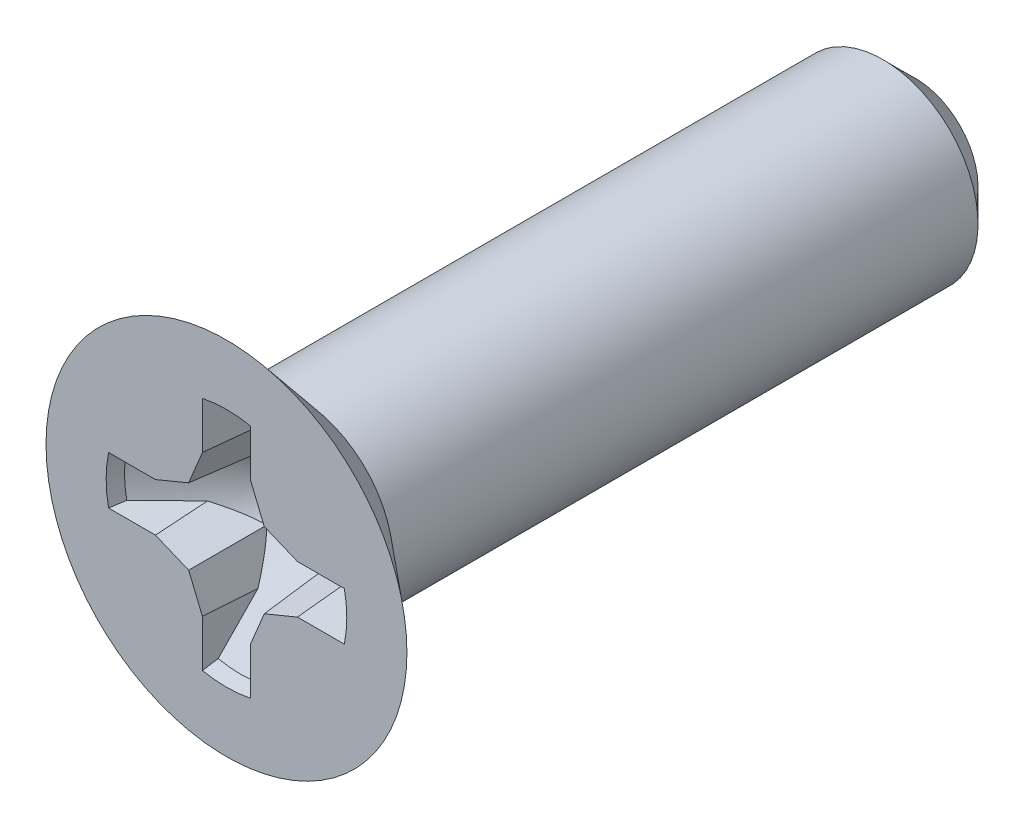
from build123d import *

# Parameters (mm, degrees)
SKETCH1_R          = 3.3274
EXTRUDE3_DEPTH     = 1.524
SKETCH4_W          = 12.7
SKETCH4_H          = 1.7526
CHAMFER1_SIZE      = 0.5953125
SKETCH26_R         = 0.8763
EXTRUDE8_DEPTH     = 1.524
CUT_EXTRUDE3_REACH = 15.544
CIRPATTERN1_COUNT  = 4
DRAFT2_ANGLE       = 5


# Read off the part's stored shape, not the designer's step: Extrude10, Draft1
with BuildPart() as part:
    # Sketch1 → Extrude3 (new body)
    with BuildSketch(Plane.XY):
        with Locations(Location((0, 0, 0), (0, 0, 180))):
            Circle(SKETCH1_R)
    extrude(amount=EXTRUDE3_DEPTH)

    # Sketch11 → Cut-Revolve3 (revolve, cut)
    with BuildSketch(Plane(origin=(0, 0, 0), x_dir=(0, 0, -1), z_dir=(1, 0, 0)), mode=Mode.PRIVATE) as cut_revolve3_sk:
        Polygon((0, 1.511167525), (-1.524, 3.3274), (0, 3.3274), align=None)
    revolve(cut_revolve3_sk.sketch.rotate(Axis((0, 0, -0.441444004), (0, 0, 1)), 90), axis=Axis((0, 0, -0.441444004), (0, 0, 1)), mode=Mode.SUBTRACT)

    # Extrude10 outline → Extrude10 (revolve)
    with BuildSketch(Plane.XZ):
        Polygon((1.7526, 0), (1.7526, 0.202585901), (1.511167525, 0.202585901), (1.511167525, 0), (0, 0), (0, -1.7526), align=None)
    revolve(axis=Axis((0, 0, 0), (0, 0, 1)))



with BuildPart() as body_2:
    # Sketch4 → Revolve1 (revolve)
    with BuildSketch(Plane(origin=(0, 0, 0), x_dir=(0, 0, -1), z_dir=(1, 0, 0)), mode=Mode.PRIVATE) as revolve1_sk:
        with Locations((4.826, 0.8763)):
            Rectangle(SKETCH4_W, SKETCH4_H)
    revolve(revolve1_sk.sketch.rotate(Axis((0, 0, 1.524), (0, 0, -1)), 180), axis=Axis((0, 0, 1.524), (0, 0, -1)))

    # Chamfer1
    chamfer1_edges = [body_2.edges().sort_by_distance(p)[0] for p in [
        (0, 1.7526, -11.176),
    ]]
    chamfer(chamfer1_edges, length=CHAMFER1_SIZE)


with BuildPart() as part_1:
    add(part.part)

    add(body_2.part)  # Extrude8 merges body 2
    # Sketch26 → Extrude8 (add)
    with BuildSketch(Plane.XY.offset(1.524)):
        Circle(SKETCH26_R)
    extrude(amount=-EXTRUDE8_DEPTH)

    # Cut-Extrude3: up to this cone (the profile starts inside it)
    cut_extrude3_end = Plane(origin=(0, 0, 1.524), z_dir=(0, 0, 1)).offset(-2.068083744) * Cone(1.192e-06, 24.522394484, 20.576731167, align=(Align.CENTER, Align.CENTER, Align.MIN), mode=Mode.PRIVATE)
    # Sketch12 → Cut-Extrude3 (cut, up to the surface)
    with BuildSketch(Plane.XY.offset(1.524), mode=Mode.PRIVATE) as cut_extrude3_sk1:
        with BuildLine():
            Line((2.173448579, 0.443653333), (1.308550956, 0.443653333))
            Line((1.308550956, 0.443653333), (0.696975982, 0.696975982))
            Line((0.696975982, 0.696975982), (0.443653333, 1.308550956))
            Line((0.443653333, 1.308550956), (0.443653333, 2.173448579))
            ThreePointArc((0.443653333, 2.173448579), (0.22295568, 2.207033704), (0, 2.218266667))
            Line((0, 2.218266667), (0, 0))
            Line((0, 0), (2.218266667, 0))
            ThreePointArc((2.218266667, 0), (2.207033704, 0.22295568), (2.173448579, 0.443653333))
        make_face()
    cut_extrude3_tool1 = extrude(cut_extrude3_sk1.sketch, amount=-CUT_EXTRUDE3_REACH, mode=Mode.PRIVATE) & cut_extrude3_end
    cut_extrude3 = cut_extrude3_tool1.solids().sort_by_distance((1.741, 0.412282, 1.524))[0]
    add(cut_extrude3, mode=Mode.SUBTRACT)

    # CirPattern1: Cut-Extrude3 ×4 about axis
    cirpattern1_axis = Axis((0, 0, 0), (0, 0, 1))
    for i in range(1, CIRPATTERN1_COUNT):
        add(cut_extrude3.rotate(cirpattern1_axis, i * 360 / CIRPATTERN1_COUNT), mode=Mode.SUBTRACT)

    # Draft1 outline → Draft1 (revolve)
    with BuildSketch(Plane.XZ):
        Polygon((2.218266667, 1.524), (2.146804001, 1.257297702), (2.218266667, 1.257297702), align=None)
    revolve(axis=Axis((0, 0, 0), (0, 0, 1)))

    # Draft2
    draft2_faces = [part_1.faces().sort_by_distance(p)[0] for p in [
        (0.443653333, 1.642629798, 1.204938596),
        (0.576807254, 0.987088954, 0.973802508),
        (0.987088954, 0.576807254, 0.973802508),
        (1.642629798, 0.443653333, 1.204938596),
        (1.642629798, -0.443653333, 1.204938596),
        (0.987088954, -0.576807254, 0.973802508),
        (0.576807254, -0.987088954, 0.973802508),
        (0.443653333, -1.642629798, 1.204938596),
        (-0.443653333, -1.642629798, 1.204938596),
        (-0.576807254, -0.987088954, 0.973802508),
        (-0.987088954, -0.576807254, 0.973802508),
        (-1.642629798, -0.443653333, 1.204938596),
        (-1.642629798, 0.443653333, 1.204938596),
        (-0.987088954, 0.576807254, 0.973802508),
        (-0.576807254, 0.987088954, 0.973802508),
        (-0.443653333, 1.642629798, 1.204938596),
    ]]
    draft(draft2_faces, Plane(origin=(0, 1.7526, 1.524), x_dir=(0, 1, 0), z_dir=(0, 0, 1)), DRAFT2_ANGLE)


solid = part_1.part
